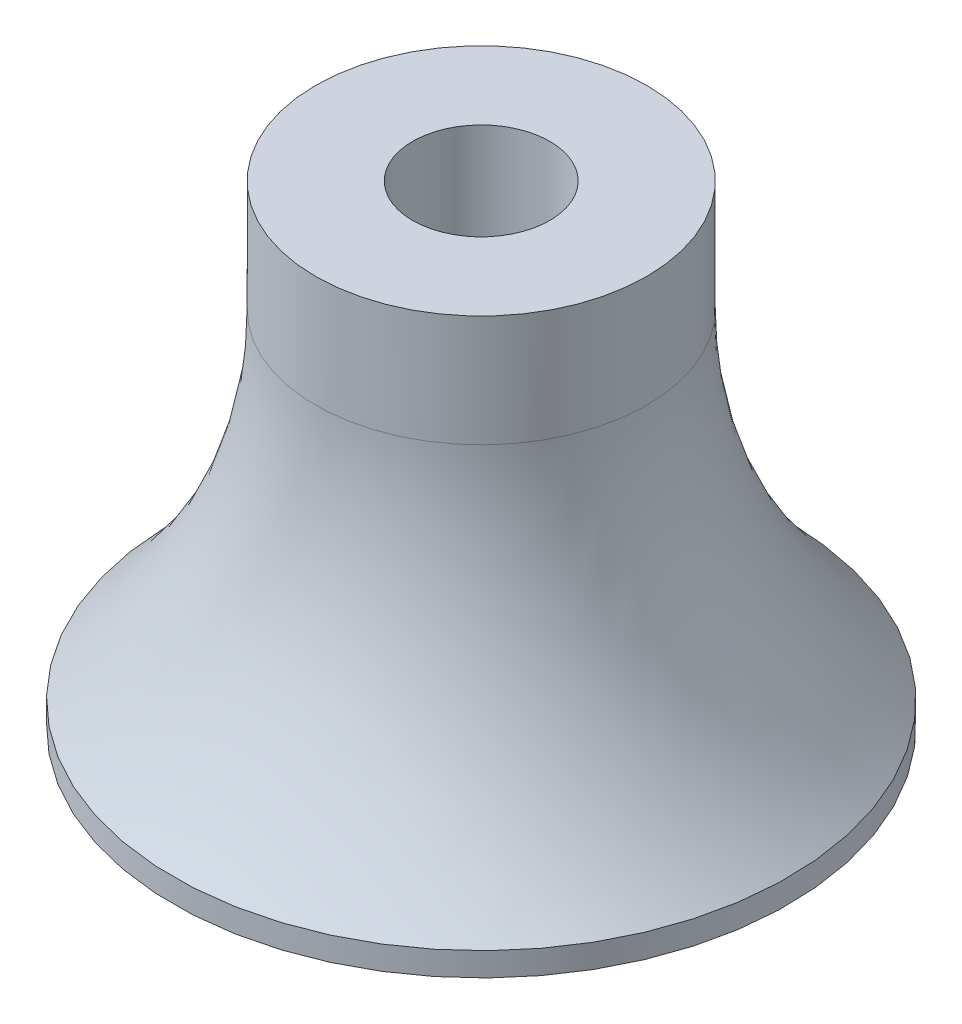
from build123d import *

# Parameters (mm, degrees)
SKETCH1_R           = 3.5
SKETCH1_R_2         = 1.45
BOSS_EXTRUDE1_DEPTH = 10
SKETCH2_R           = 6.5
SKETCH2_R_2         = 3.5
SKETCH2_R_3         = 1.45
BOSS_EXTRUDE2_DEPTH = 0.5
FILLET1_R           = 10


with BuildPart() as part:
    # Sketch1 → Boss-Extrude1 (new body)
    with BuildSketch(Plane(origin=(0, 0, 0), x_dir=(1, 0, 0), z_dir=(0, 1, 0))):
        with Locations(Location((0, 0, 0), (0, 0, 270))):
            Circle(SKETCH1_R)
        with Locations(Location((0, 0, 0), (0, 0, 270))):
            Circle(SKETCH1_R_2, mode=Mode.SUBTRACT)
    extrude(amount=BOSS_EXTRUDE1_DEPTH)

    # Sketch2 → Boss-Extrude2 (add)
    # profile 1 of 2: a face of its own
    with BuildSketch(Plane.XZ):
        with Locations(Location((0, 0, 0), (0, 0, 270))):
            Circle(SKETCH2_R)
        with Locations(Location((0, 0, 0), (0, 0, 270))):
            Circle(SKETCH2_R_2, mode=Mode.SUBTRACT)
    # profile 2 of 2: a face of its own
    with BuildSketch(Plane.XZ):
        with Locations(Location((0, 0, 0), (0, 0, 270))):
            Circle(SKETCH2_R_2)
        with Locations(Location((0, 0, 0), (0, 0, 90))):
            Circle(SKETCH2_R_3, mode=Mode.SUBTRACT)
    extrude(amount=-BOSS_EXTRUDE2_DEPTH)

    # Fillet1
    # the kernel refuses this fillet: 10 mm, written as the material it adds along each edge
    with BuildSketch(Plane(origin=(0, 0.5, 0), x_dir=(0, 0, 1), z_dir=(1, 0, 0))) as fillet1_piece_1:
        with BuildLine():
            CenterArc((13.5, -7.141428429), FILLET1_R, 134.427004001, 45.572995999)
            Line((3.5, -7.141428429), (3.3, -7.141428429))
            Line((3.3, -7.141428429), (3.3, 0))
            Line((3.3, 0), (3.5, 0.2))
            ThreePointArc((3.5, 0.2), (5, 0.2), (6.36, 0.142828569))
            Line((6.36, 0.142828569), (6.5, 0))
        make_face()
    revolve(axis=Axis((0, 0.5, 0), (0, -1, 0)))


solid = part.part
